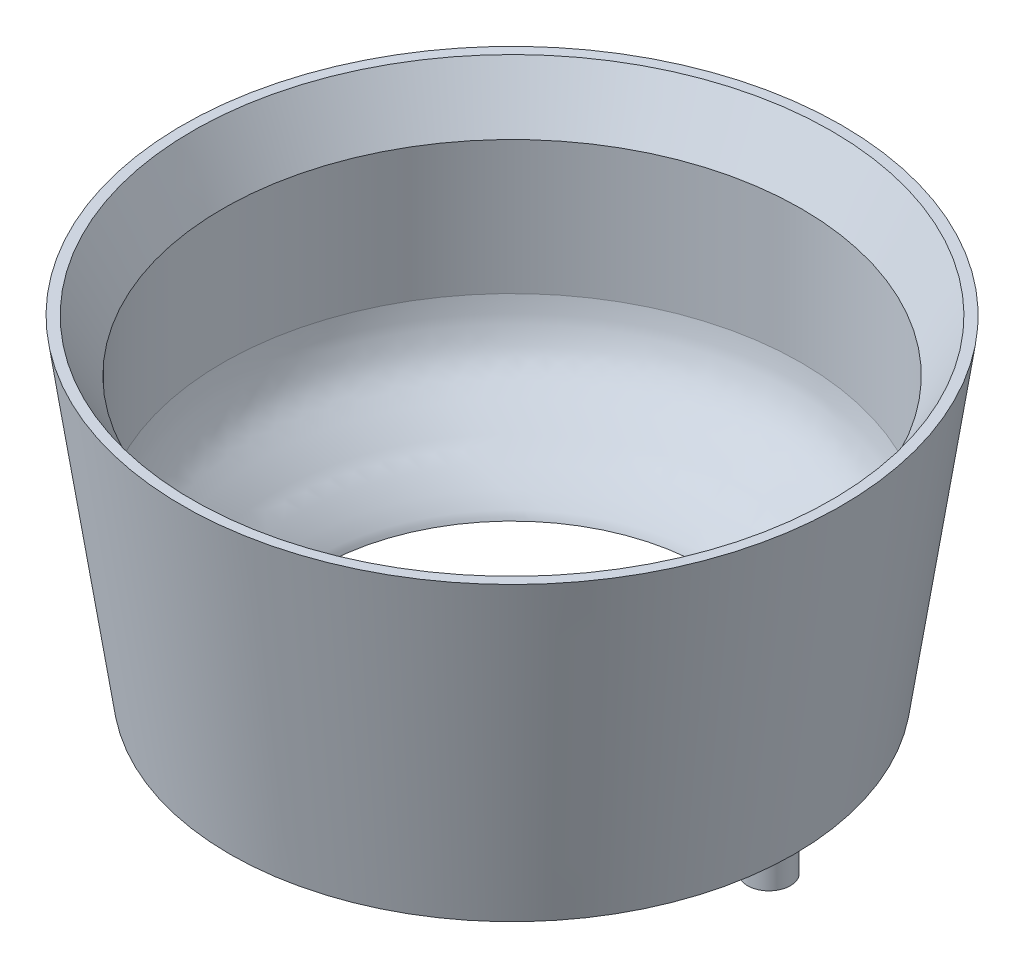
from build123d import *
from OCP.BRepAlgoAPI import BRepAlgoAPI_Cut
from OCP.TopTools import TopTools_ListOfShape

# Parameters (mm, degrees)
SKETCH4_R                       = 3
BOSS_EXTRUDE1_DEPTH             = 2
SKETCH4_2_R                     = 3
BOSS_EXTRUDE3_DEPTH             = 2
BOSS_EXTRUDE3_DIRECTION_2_REACH = 82.882
SKETCH13_R                      = 1.5
CUT_EXTRUDE1_DEPTH              = 6
SKETCH14_R                      = 2
CUT_EXTRUDE2_DEPTH              = 0.5
CHAMFER3_SIZE                   = 0.55


with BuildPart() as part:
    # Sketch2 → Revolve6 (revolve)
    with BuildSketch(Plane(origin=(0, 0, 0), x_dir=(0, 0, -1), z_dir=(1, 0, 0))):
        with BuildLine():
            Line((26.5077562, 274.996982717), (26.5077562, 273.848618937))
            Line((26.5077562, 273.848618937), (39.220771912, 273.848618937))
            Line((39.220771912, 273.848618937), (46.181267187, 321.561079724))
            Line((46.181267187, 321.561079724), (44.775299462, 321.561079724))
            Line((44.775299462, 321.561079724), (40.547674755, 314.238618937))
            Line((40.547674755, 314.238618937), (40.547674755, 295.540718438))
            add(Edge.make_bspline(
                [(40.547674755, 295.540718438), (40.447740466, 295.012709616), (40.292777353, 293.970757619), (39.930889755, 292.587532753), (39.516186416, 291.581451359), (39.108370782, 290.57804728), (38.439698054, 289.316986818), (37.331416086, 288.032583079), (36.368363881, 287.115418474), (35.630231264, 286.340079673), (35.016472726, 285.762737126), (34.394259795, 285.247169223), (33.635524662, 284.556557999), (32.920361334, 283.771384038), (32.129651901, 282.986073936), (31.485241784, 282.459482323), (30.914997208, 281.963476573), (30.371700346, 281.391298159), (29.782796159, 280.80462685), (29.227584581, 280.262154528), (28.724752618, 279.674853681), (28.180386253, 279.039651715), (27.651838315, 278.470209992), (27.308145935, 277.876839187), (26.995230081, 277.127164256), (26.597952618, 276.164510632), (26.464811583, 275.470548141), (26.5077562, 274.996982717)],
                knots=[0, 0, 0, 0, 0.062544048, 0.125088096, 0.156360121, 0.187632145, 0.250176193, 0.312720241, 0.375264289, 0.406536313, 0.437808337, 0.469080362, 0.500352386, 0.562896434, 0.594168458, 0.625440482, 0.656712506, 0.68798453, 0.719256554, 0.750528579, 0.781800603, 0.813072627, 0.844344651, 0.875616675, 0.906888699, 0.938160723, 1.000704771, 1.000704771, 1.000704771, 1.000704771], degree=3))
        make_face()
    revolve(axis=Axis((0, 5, 0), (0, 1, 0)))

    # Sketch4 → Boss-Extrude1 (add)
    with BuildSketch(Plane.XZ.offset(-273.848618937)):
        with Locations(Location((-31.176914536, 18, 0), (0, 0, 270))):
            Circle(SKETCH4_R)
        with Locations(Location((36, 0, 0), (0, 0, 270))):
            Circle(SKETCH4_R)
    extrude(amount=BOSS_EXTRUDE1_DEPTH)

    # Sketch7 → Revolve7 (revolve)
    with BuildSketch(Plane(origin=(0, 0, 0), x_dir=(0, 0, -1), z_dir=(1, 0, 0))):
        with BuildLine():
            Line((39.220771912, 273.848618937), (39.220771912, 272.319355593))
            ThreePointArc((39.220771912, 272.319355593), (32.873157949, 273.157923648), (26.5077562, 273.848618937))
            Line((26.5077562, 273.848618937), (26.5077562, 274.348618937))
            Line((26.5077562, 274.348618937), (39.220771912, 274.348618937))
            Line((39.220771912, 274.348618937), (39.220771912, 273.848618937))
        make_face()
    revolve(axis=Axis((0, 5, 0), (0, 1, 0)))


with BuildPart() as cut_revolve3_tool:
    # Sketch12 → Cut-Revolve3 (revolve)
    with BuildSketch(Plane(origin=(0, 0, 0), x_dir=(0, 0, -1), z_dir=(1, 0, 0))):
        with BuildLine():
            Line((26.0877562, 277.526559948), (26.0877562, 267.526559948))
            Line((26.0877562, 267.526559948), (40.0877562, 267.526559948))
            Line((40.0877562, 267.526559948), (40.0877562, 275.852377736))
            ThreePointArc((40.0877562, 275.852377736), (33.098343341, 276.778001597), (26.0877562, 277.526559948))
        make_face()
    revolve(axis=Axis((0, 5, 0), (0, 1, 0)))


with BuildPart() as part_1:
    add(part.part)

    # Cut-Revolve3: cut by cut_revolve3_tool, with a tolerance
    cut_revolve3_stock = TopTools_ListOfShape()
    cut_revolve3_stock.Append(part_1.part.wrapped)
    cut_revolve3_tools = TopTools_ListOfShape()
    cut_revolve3_tools.Append(cut_revolve3_tool.part.wrapped)
    cut_revolve3_cut = BRepAlgoAPI_Cut()
    cut_revolve3_cut.SetArguments(cut_revolve3_stock)
    cut_revolve3_cut.SetTools(cut_revolve3_tools)
    cut_revolve3_cut.SetFuzzyValue(0.00001)
    cut_revolve3_cut.Build()
    add(Compound.cast(cut_revolve3_cut.Shape()).solids(), mode=Mode.REPLACE)

    # Sketch4<2> → Boss-Extrude3 (add)
    with BuildSketch(Plane.XZ.offset(-273.848618937)):
        with Locations(Location((-31.176914536, 18, 0), (0, 0, 270))):
            Circle(SKETCH4_2_R)
        with Locations(Location((36, 0, 0), (0, 0, 270))):
            Circle(SKETCH4_2_R)
    extrude(amount=BOSS_EXTRUDE3_DEPTH)

    # Sketch4<2> → Boss-Extrude3 direction 2 (add, up to next)
    with BuildSketch(Plane.XZ.offset(-273.848618937), mode=Mode.PRIVATE) as boss_extrude3_direction_2_sk1:
        with Locations(Location((-31.176914536, 18, 0), (0, 0, 270))):
            Circle(SKETCH4_2_R)
    boss_extrude3_direction_2_tool1 = extrude(boss_extrude3_direction_2_sk1.sketch, amount=-BOSS_EXTRUDE3_DIRECTION_2_REACH, mode=Mode.PRIVATE) - part_1.part
    # Sketch4<2> → Boss-Extrude3 direction 2 (add, up to next)
    with BuildSketch(Plane.XZ.offset(-273.848618937), mode=Mode.PRIVATE) as boss_extrude3_direction_2_sk2:
        with Locations(Location((36, 0, 0), (0, 0, 270))):
            Circle(SKETCH4_2_R)
    boss_extrude3_direction_2_tool2 = extrude(boss_extrude3_direction_2_sk2.sketch, amount=-BOSS_EXTRUDE3_DIRECTION_2_REACH, mode=Mode.PRIVATE) - part_1.part
    add(boss_extrude3_direction_2_tool1.solids().sort_by_distance((-31.176915, 273.848619, 18))[0])
    add(boss_extrude3_direction_2_tool2.solids().sort_by_distance((36, 273.848619, 0))[0])

    # Sketch13 → Cut-Extrude1 (cut)
    with BuildSketch(Plane.XZ.offset(-271.848618937)):
        with Locations(Location((-31.176914536, 18, 0), (0, 0, 270))):
            Circle(SKETCH13_R)
        with Locations(Location((36, 0, 0), (0, 0, 270))):
            Circle(SKETCH13_R)
    extrude(amount=-CUT_EXTRUDE1_DEPTH, mode=Mode.SUBTRACT)

    # Sketch14 → Cut-Extrude2 (cut)
    with BuildSketch(Plane.XZ.offset(-271.848618937)):
        with Locations(Location((-31.176914536, 18, 0), (0, 0, 270))):
            Circle(SKETCH14_R)
        with Locations(Location((36, 0, 0), (0, 0, 270))):
            Circle(SKETCH14_R)
    extrude(amount=-CUT_EXTRUDE2_DEPTH, mode=Mode.SUBTRACT)

    # Chamfer3
    # the kernel refuses this chamfer: 0.55 mm, written as the material it takes off along each edge
    with BuildSketch(Plane(origin=(36, 271.848618937, 0), x_dir=(0, 0, -1), z_dir=(-1, 0, 0))) as chamfer3_piece_1_section:
        Polygon((2 + CHAMFER3_SIZE, 0), (2, -CHAMFER3_SIZE), (2, 0), align=None)
    chamfer3_piece_1 = revolve(axis=Axis((36, 271.848618937, 0), (0, -1, 0)), mode=Mode.PRIVATE)
    chamfer3_piece_1 = split(chamfer3_piece_1, bisect_by=Plane(origin=(36, 272.348618937, 0), z_dir=(0, -1, 0)), keep=Keep.TOP, mode=Mode.PRIVATE)
    add(chamfer3_piece_1, mode=Mode.SUBTRACT)
    with BuildSketch(Plane(origin=(-31.176914536, 271.848618937, 18), x_dir=(0, 0, -1), z_dir=(-1, 0, 0))) as chamfer3_piece_2_section:
        Polygon((2 + CHAMFER3_SIZE, 0), (2, -CHAMFER3_SIZE), (2, 0), align=None)
    chamfer3_piece_2 = revolve(axis=Axis((-31.176914536, 271.848618937, 18), (0, -1, 0)), mode=Mode.PRIVATE)
    chamfer3_piece_2 = split(chamfer3_piece_2, bisect_by=Plane(origin=(-31.176914536, 272.348618937, 18), z_dir=(0, -1, 0)), keep=Keep.TOP, mode=Mode.PRIVATE)
    add(chamfer3_piece_2, mode=Mode.SUBTRACT)


solid = part_1.part
